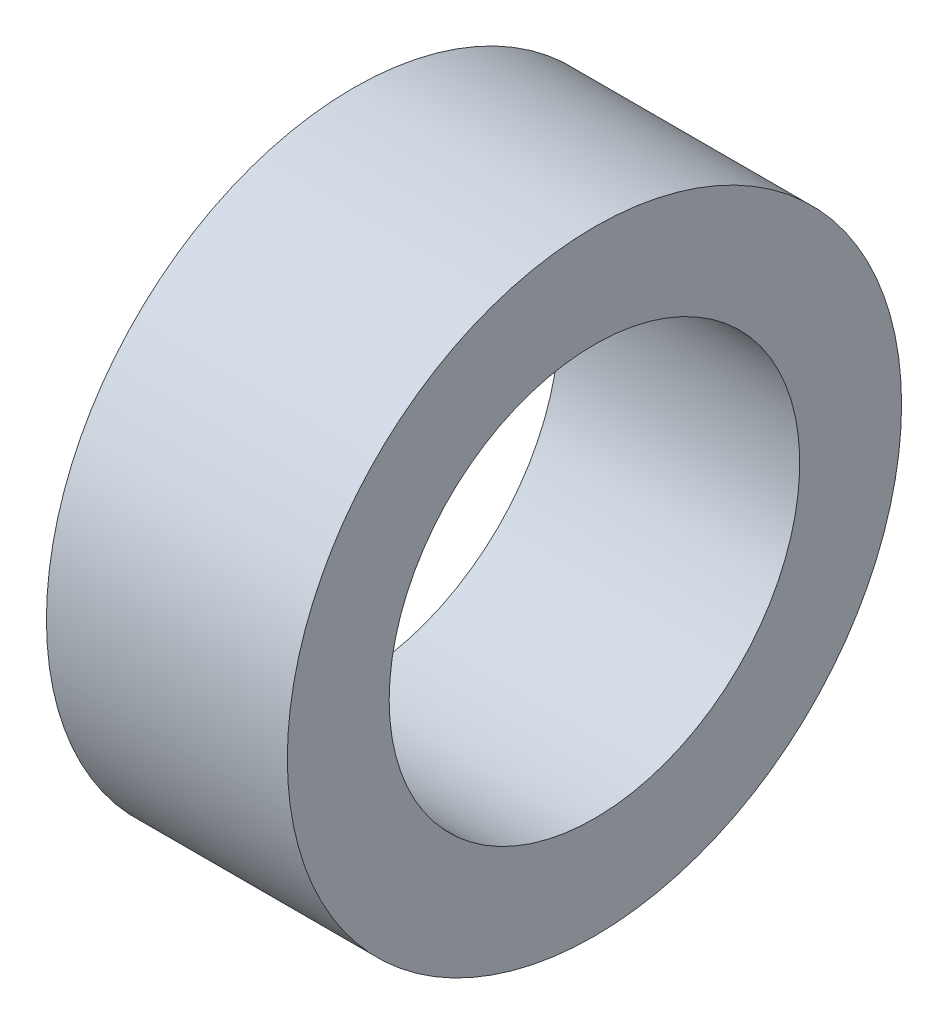
from build123d import *

# Parameters (mm, degrees)
SKETCH1_W = 4.806249952
SKETCH1_H = 2.032


with BuildPart() as part:
    # Sketch1 → Revolve1 (revolve)
    with BuildSketch(Plane.XY):
        with Locations((32.918749976, 5.11175)):
            Rectangle(SKETCH1_W, SKETCH1_H)
    revolve(axis=Axis((0, 0, 0), (1, 0, 0)))


solid = part.part
